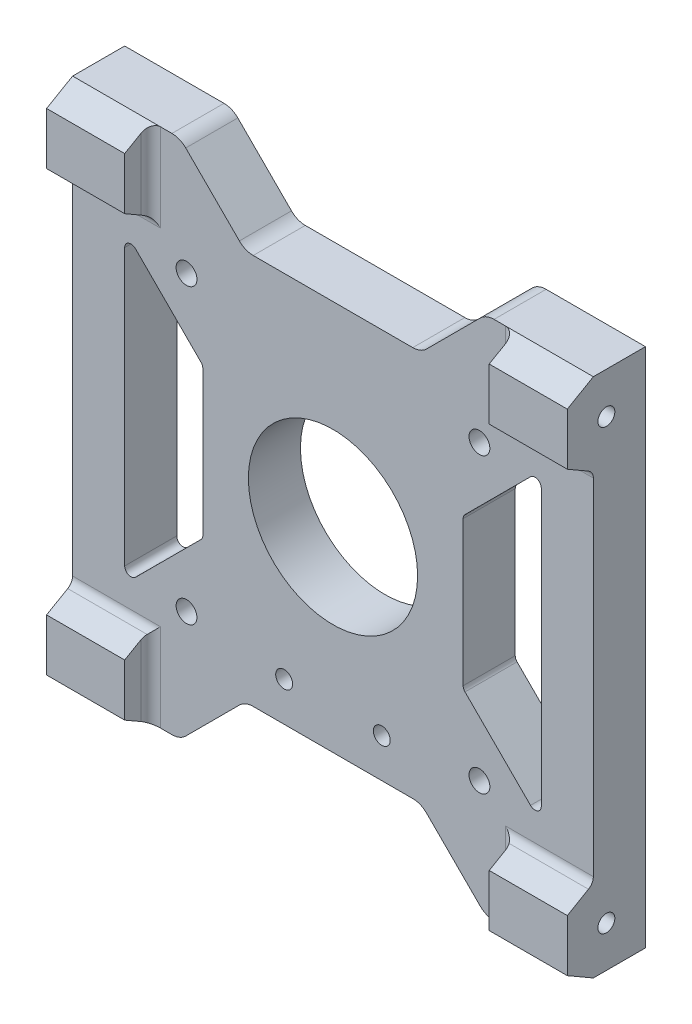
from build123d import *

# Parameters (mm, degrees)
SKETCH_1_W             = 80
SKETCH_1_H             = 80
EXTRUDE_1_DEPTH        = 8
SKETCH_6_R             = 13
CUT_EXTRUDE_3_DEPTH    = 50
EXTRUDE_2_DEPTH        = 12
FILLET_1_R             = 1.5
FILLET_1_OF_MIRROR_1_R = 1.5
SKETCH_8_R             = 1.3
CUT_EXTRUDE_4_DEPTH    = 10
SKETCH_9_R             = 1.3
CUT_EXTRUDE_5_DEPTH    = 10
SKETCH_10_R            = 1.6
CUT_EXTRUDE_6_DEPTH    = 10
CUT_EXTRUDE_7_DEPTH    = 10
FILLET_2_R             = 3


with BuildPart() as part:
    # 草图1 → 凸台-拉伸1 (new body)
    with BuildSketch(Plane.XY):
        Rectangle(SKETCH_1_W, SKETCH_1_H)
    extrude(amount=EXTRUDE_1_DEPTH)

    # 草图6 → 切除-拉伸3 (cut)
    with BuildSketch(Plane.XY.offset(8)):
        Circle(SKETCH_6_R)
    extrude(amount=-CUT_EXTRUDE_3_DEPTH, mode=Mode.SUBTRACT)

    # 草图7 → 凸台-拉伸2 (add)
    with BuildSketch(Plane.ZY.offset(40)):
        Polygon((8, 40), (8, 27.381197846), (12, 29.690598923), (12, 37.690598923), align=None)
        Polygon((12, -37.690598923), (8, -40), (8, -27.381197846), (12, -29.690598923), align=None)
    extrude_2 = extrude(amount=-EXTRUDE_2_DEPTH)

    # 圆角1
    fillet_1_edges = [part.edges().sort_by_distance(p)[0] for p in [
        (-34, 27.381197846, 8),
        (-28, 33.690598923, 8),
        (-28, -33.690598923, 8),
        (-34, -27.381197846, 8),
    ]]
    fillet(fillet_1_edges, radius=FILLET_1_R)

    # 镜向1: 凸台-拉伸2 across plane
    add(extrude_2.mirror(Plane(origin=(0, 0, 0), x_dir=(0, 0, 1), z_dir=(1, 0, 0))))

    # 圆角1 of 镜向1
    fillet_1_of_mirror_1_edges = [part.edges().sort_by_distance(p)[0] for p in [
        (34, 27.381197846, 8),
        (28, 33.690598923, 8),
        (28, -33.690598923, 8),
        (34, -27.381197846, 8),
    ]]
    fillet(fillet_1_of_mirror_1_edges, radius=FILLET_1_OF_MIRROR_1_R)

    # 草图8 → 切除-拉伸4 (cut)
    with BuildSketch(Plane.ZY.offset(40)):
        with Locations((6, 33.690598923)):
            Circle(SKETCH_8_R)
        with Locations((6, -33.690598923)):
            Circle(SKETCH_8_R)
    cut_extrude_4 = extrude(amount=-CUT_EXTRUDE_4_DEPTH, mode=Mode.SUBTRACT)

    # 镜向2: 切除-拉伸4 across plane
    add(cut_extrude_4.mirror(Plane(origin=(0, 0, 0), x_dir=(0, 0, 1), z_dir=(1, 0, 0))), mode=Mode.SUBTRACT)

    # 草图9 → 切除-拉伸5 (cut)
    with BuildSketch(Plane.XY.offset(8)):
        with Locations((7.5, -24)):
            Circle(SKETCH_9_R)
        with Locations((-7.5, -24)):
            Circle(SKETCH_9_R)
    extrude(amount=-CUT_EXTRUDE_5_DEPTH, mode=Mode.SUBTRACT)

    # 草图10 → 切除-拉伸6 (cut)
    with BuildSketch(Plane.XY.offset(8)):
        with Locations((22.5, -22.5)):
            Circle(SKETCH_10_R)
        with Locations((-22.5, -22.5)):
            Circle(SKETCH_10_R)
        with Locations((22.5, 22.5)):
            Circle(SKETCH_10_R)
        with Locations((-22.5, 22.5)):
            Circle(SKETCH_10_R)
    extrude(amount=-CUT_EXTRUDE_6_DEPTH, mode=Mode.SUBTRACT)

    # 草图11 → 切除-拉伸7 (cut)
    with BuildSketch(Plane.XY.offset(8)):
        with BuildLine():
            Line((-23.5, 40), (-14.378679656, 30.878679656))
            ThreePointArc((-14.378679656, 30.878679656), (-13.40540961, 30.228361402), (-12.257359313, 30))
            Line((-12.257359313, 30), (12.257359313, 30))
            ThreePointArc((12.257359313, 30), (13.40540961, 30.228361402), (14.378679656, 30.878679656))
            Line((14.378679656, 30.878679656), (23.5, 40))
            Line((23.5, 40), (-23.5, 40))
        make_face()
        with BuildLine():
            Line((-32, 21.178048171), (-32, -21.178048171))
            ThreePointArc((-32, -21.178048171), (-31.402395233, -22.072426909), (-30.347403579, -21.862576022))
            Line((-30.347403579, -21.862576022), (-20.28354072, -11.798713162))
            ThreePointArc((-20.28354072, -11.798713162), (-20.073689832, -11.484649115), (-20, -11.114185312))
            Line((-20, -11.114185312), (-20, 11.114185312))
            ThreePointArc((-20, 11.114185312), (-20.073689832, 11.484649115), (-20.28354072, 11.798713162))
            Line((-20.28354072, 11.798713162), (-30.347403579, 21.862576022))
            ThreePointArc((-30.347403579, 21.862576022), (-31.402395233, 22.072426909), (-32, 21.178048171))
        make_face()
        with BuildLine():
            Line((-23.5, -40), (23.5, -40))
            Line((23.5, -40), (14.378679656, -30.878679656))
            ThreePointArc((14.378679656, -30.878679656), (13.40540961, -30.228361402), (12.257359313, -30))
            Line((12.257359313, -30), (-12.257359313, -30))
            ThreePointArc((-12.257359313, -30), (-13.40540961, -30.228361402), (-14.378679656, -30.878679656))
            Line((-14.378679656, -30.878679656), (-23.5, -40))
        make_face()
        with BuildLine():
            Line((20.28354072, 11.798713162), (30.347403579, 21.862576022))
            ThreePointArc((30.347403579, 21.862576022), (31.402395233, 22.072426909), (32, 21.178048171))
            Line((32, 21.178048171), (32, -21.178048171))
            ThreePointArc((32, -21.178048171), (31.402395233, -22.072426909), (30.347403579, -21.862576022))
            Line((30.347403579, -21.862576022), (20.28354072, -11.798713162))
            ThreePointArc((20.28354072, -11.798713162), (20.073689832, -11.484649115), (20, -11.114185312))
            Line((20, -11.114185312), (20, 11.114185312))
            ThreePointArc((20, 11.114185312), (20.073689832, 11.484649115), (20.28354072, 11.798713162))
        make_face()
    extrude(amount=-CUT_EXTRUDE_7_DEPTH, mode=Mode.SUBTRACT)

    # 圆角2
    fillet_2_edges = [part.edges().sort_by_distance(p)[0] for p in [
        (23.5, -40, 4),
        (-23.5, -40, 4),
        (23.5, 40, 4),
        (-23.5, 40, 4),
    ]]
    fillet(fillet_2_edges, radius=FILLET_2_R)


solid = part.part
